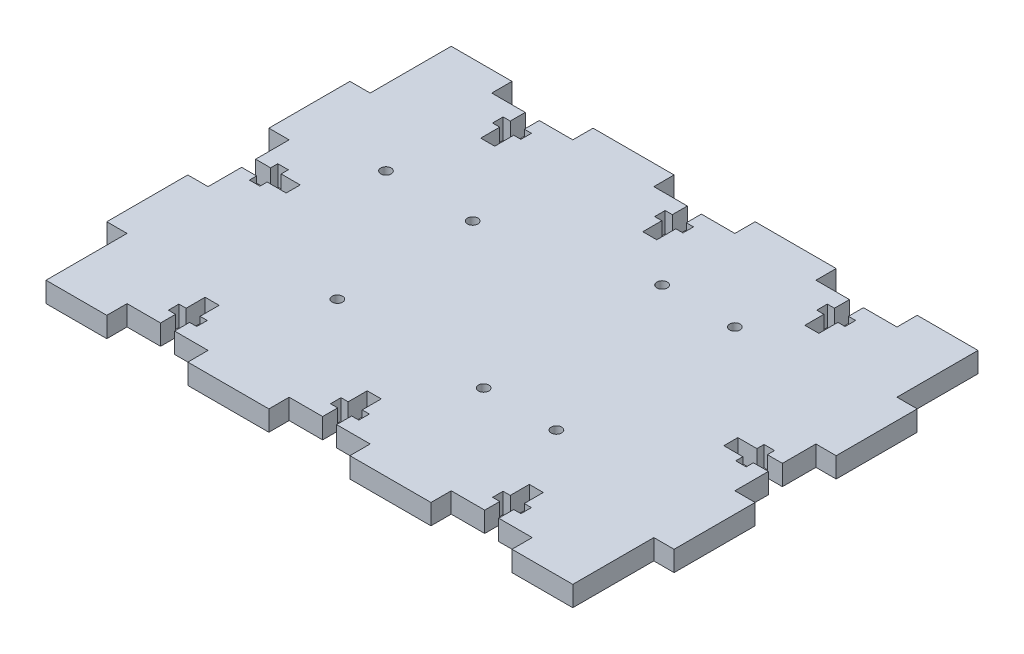
from build123d import *

# Parameters (mm, degrees)
SKETCH1_W                 = 177.8
SKETCH1_H                 = 127
BOSS_EXTRUDE1_DEPTH       = 6.35
SKETCH2_W                 = 6.35
SKETCH2_H                 = 25.4
CUT_EXTRUDE1_DEPTH        = 6.35
LPATTERN1_COUNT           = 3
LPATTERN1_PITCH           = 50.8
LPATTERN1_COUNT_DIR2      = 2
LPATTERN1_PITCH_DIR2      = 171.45
SKETCH3_W                 = 25.4
SKETCH3_H                 = 6.35
CUT_EXTRUDE2_DEPTH        = 6.35
LPATTERN2_COUNT           = 3
LPATTERN2_PITCH           = 50.8
LPATTERN2_COUNT_DIR2      = 2
LPATTERN2_PITCH_DIR2      = 120.65
SKETCH4_W                 = 13.97
SKETCH4_H                 = 4.3942
SKETCH4_W_2               = 3.302
SKETCH4_H_2               = 8.89
CUT_EXTRUDE3_DEPTH        = 8.89
SKETCH5_W                 = 4.3942
SKETCH5_H                 = 13.97
SKETCH5_W_2               = 8.89
SKETCH5_H_2               = 3.302
CUT_EXTRUDE4_DEPTH        = 30.48
LPATTERN3_COUNT           = 3
LPATTERN3_PITCH           = 50.8
MIRROR2_COPY_1_SKETCH_W   = 4.3942
MIRROR2_COPY_1_SKETCH_H   = 13.97
MIRROR2_COPY_1_SKETCH_W_2 = 8.89
MIRROR2_COPY_1_SKETCH_H_2 = 3.302
MIRROR2_COPY_1_DEPTH      = 30.48
MIRROR2_COPY_2_SKETCH_W   = 4.3942
MIRROR2_COPY_2_SKETCH_H   = 13.97
MIRROR2_COPY_2_SKETCH_W_2 = 8.89
MIRROR2_COPY_2_SKETCH_H_2 = 3.302
MIRROR2_COPY_2_DEPTH      = 30.48
MIRROR2_COPY_3_SKETCH_W   = 4.3942
MIRROR2_COPY_3_SKETCH_H   = 13.97
MIRROR2_COPY_3_SKETCH_W_2 = 8.89
MIRROR2_COPY_3_SKETCH_H_2 = 3.302
MIRROR2_COPY_3_DEPTH      = 30.48
F_4_CLEARANCE_HOLE2_D     = 3.2639
F_4_CLEARANCE_HOLE2_DEPTH = 10.16
F_4_CLEARANCE_HOLE2_TIP   = 0.980574487
F_4_CLEARANCE_HOLE3_D     = 3.2639
F_4_CLEARANCE_HOLE3_DEPTH = 10.16
F_4_CLEARANCE_HOLE3_TIP   = 0.980574487


with BuildPart() as part:
    # Sketch1 → Boss-Extrude1 (new body)
    with BuildSketch(Plane(origin=(0, 0, 0), x_dir=(1, 0, 0), z_dir=(0, 1, 0))):
        with Locations((88.9, 63.5)):
            Rectangle(SKETCH1_W, SKETCH1_H)
    extrude(amount=BOSS_EXTRUDE1_DEPTH)

    # Sketch2 → Cut-Extrude1 (cut)
    with BuildSketch(Plane(origin=(0, 6.35, 0), x_dir=(1, 0, 0), z_dir=(0, 1, 0))):
        with Locations((3.175, 114.3)):
            Rectangle(SKETCH2_W, SKETCH2_H)
    cut_extrude1 = extrude(amount=-CUT_EXTRUDE1_DEPTH, mode=Mode.SUBTRACT)

    # LPattern1: Cut-Extrude1 3 × 2
    with Locations(*[(j * LPATTERN1_PITCH_DIR2, 0, i * LPATTERN1_PITCH) for i in range(LPATTERN1_COUNT) for j in range(LPATTERN1_COUNT_DIR2) if (i, j) != (0, 0)]):
        add(cut_extrude1, mode=Mode.SUBTRACT)

    # Sketch3 → Cut-Extrude2 (cut)
    with BuildSketch(Plane(origin=(0, 6.35, 0), x_dir=(1, 0, 0), z_dir=(0, 1, 0))):
        with Locations((38.1, 3.175)):
            Rectangle(SKETCH3_W, SKETCH3_H)
    cut_extrude2 = extrude(amount=-CUT_EXTRUDE2_DEPTH, mode=Mode.SUBTRACT)

    # LPattern2: Cut-Extrude2 3 × 2
    with Locations(*[(i * LPATTERN2_PITCH, 0, -j * LPATTERN2_PITCH_DIR2) for i in range(LPATTERN2_COUNT) for j in range(LPATTERN2_COUNT_DIR2) if (i, j) != (0, 0)]):
        add(cut_extrude2, mode=Mode.SUBTRACT)

    # Sketch4 → Cut-Extrude3 (cut)
    with BuildSketch(Plane(origin=(0, 6.35, 0), x_dir=(1, 0, 0), z_dir=(0, 1, 0))):
        with Locations((164.465, 63.5)):
            Rectangle(SKETCH4_W, SKETCH4_H)
        with Locations((165.1, 63.5)):
            Rectangle(SKETCH4_W_2, SKETCH4_H_2)
    cut_extrude3 = extrude(amount=-CUT_EXTRUDE3_DEPTH, mode=Mode.SUBTRACT)

    # Mirror1: Cut-Extrude3 across plane
    add(cut_extrude3.mirror(Plane(origin=(88.9, 0, 0), x_dir=(0, 0, 1), z_dir=(1, 0, 0))), mode=Mode.SUBTRACT)

    # Sketch5 → Cut-Extrude4 (cut)
    with BuildSketch(Plane(origin=(0, 6.35, 0), x_dir=(1, 0, 0), z_dir=(0, 1, 0))):
        with Locations((38.1, 13.335)):
            Rectangle(SKETCH5_W, SKETCH5_H)
        with Locations((38.1, 12.7)):
            Rectangle(SKETCH5_W_2, SKETCH5_H_2)
    cut_extrude4 = extrude(amount=-CUT_EXTRUDE4_DEPTH, mode=Mode.SUBTRACT)

    # LPattern3: Cut-Extrude4 ×3
    with Locations(*[(i * LPATTERN3_PITCH, 0, 0) for i in range(1, LPATTERN3_COUNT)]):
        add(cut_extrude4, mode=Mode.SUBTRACT)

    # Mirror2 copy 1 sketch → Mirror2 copy 1 (cut)
    with BuildSketch(Plane(origin=(50.8, 6.35, -127), x_dir=(1, 0, 0), z_dir=(0, 1, 0))):
        with Locations((38.1, -13.335)):
            Rectangle(MIRROR2_COPY_1_SKETCH_W, MIRROR2_COPY_1_SKETCH_H)
        with Locations((38.1, -12.7)):
            Rectangle(MIRROR2_COPY_1_SKETCH_W_2, MIRROR2_COPY_1_SKETCH_H_2)
    extrude(amount=-MIRROR2_COPY_1_DEPTH, mode=Mode.SUBTRACT)

    # Mirror2 copy 2 sketch → Mirror2 copy 2 (cut)
    with BuildSketch(Plane(origin=(101.6, 6.35, -127), x_dir=(1, 0, 0), z_dir=(0, 1, 0))):
        with Locations((38.1, -13.335)):
            Rectangle(MIRROR2_COPY_2_SKETCH_W, MIRROR2_COPY_2_SKETCH_H)
        with Locations((38.1, -12.7)):
            Rectangle(MIRROR2_COPY_2_SKETCH_W_2, MIRROR2_COPY_2_SKETCH_H_2)
    extrude(amount=-MIRROR2_COPY_2_DEPTH, mode=Mode.SUBTRACT)

    # Mirror2 copy 3 sketch → Mirror2 copy 3 (cut)
    with BuildSketch(Plane(origin=(0, 6.35, -127), x_dir=(1, 0, 0), z_dir=(0, 1, 0))):
        with Locations((38.1, -13.335)):
            Rectangle(MIRROR2_COPY_3_SKETCH_W, MIRROR2_COPY_3_SKETCH_H)
        with Locations((38.1, -12.7)):
            Rectangle(MIRROR2_COPY_3_SKETCH_W_2, MIRROR2_COPY_3_SKETCH_H_2)
    extrude(amount=-MIRROR2_COPY_3_DEPTH, mode=Mode.SUBTRACT)

    # #4 Clearance Hole2
    with Locations(Plane(origin=(0, 6.35, 0), x_dir=(1, 0, 0), z_dir=(0, 1, 0))):
        with Locations((104.1908, 95.25), (127, 95.25), (127, 39.3192), (104.1908, 39.3192)):
            Hole(F_4_CLEARANCE_HOLE2_D / 2, depth=F_4_CLEARANCE_HOLE2_DEPTH)
            with Locations((0, 0, -(F_4_CLEARANCE_HOLE2_DEPTH + F_4_CLEARANCE_HOLE2_TIP / 2))):  # 118° drill point
                Cone(0, F_4_CLEARANCE_HOLE2_D / 2, F_4_CLEARANCE_HOLE2_TIP, mode=Mode.SUBTRACT)

    # #4 Clearance Hole3
    with Locations(Plane(origin=(0, 6.35, 0), x_dir=(1, 0, 0), z_dir=(0, 1, 0))):
        with Locations((29.972, 82.931), (57.15, 82.931), (57.15, 40.513)):
            Hole(F_4_CLEARANCE_HOLE3_D / 2, depth=F_4_CLEARANCE_HOLE3_DEPTH)
            with Locations((0, 0, -(F_4_CLEARANCE_HOLE3_DEPTH + F_4_CLEARANCE_HOLE3_TIP / 2))):  # 118° drill point
                Cone(0, F_4_CLEARANCE_HOLE3_D / 2, F_4_CLEARANCE_HOLE3_TIP, mode=Mode.SUBTRACT)


solid = part.part
